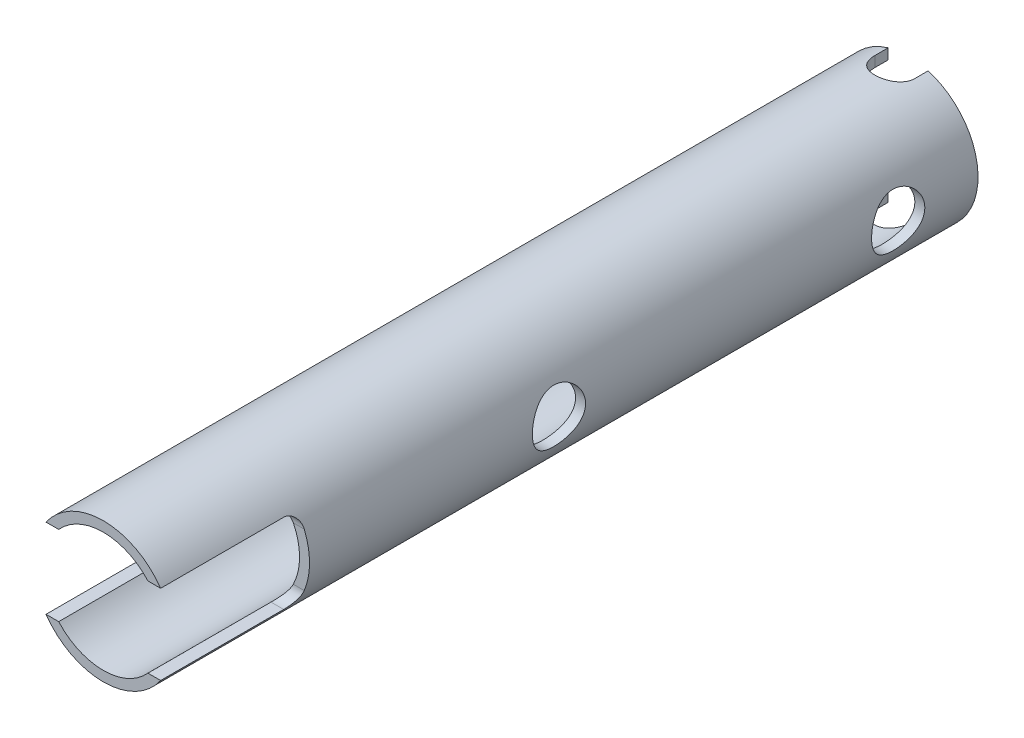
from build123d import *

# Parameters (mm, degrees)
EXTRUDE_1_DEPTH          = 20
EXTRUDE_1_DEPTH_BACK     = 118
SKETCH_1_R               = 10.5
SKETCH_1_R_2             = 9
CUT_EXTRUDE_1_DEPTH      = 119.930652062
CUT_EXTRUDE_1_DEPTH_BACK = 119.930652062
CUT_EXTRUDE_3_DEPTH      = 20
CUT_EXTRUDE_3_DEPTH_BACK = 119.930652179
CUT_EXTRUDE_4_DEPTH      = 20
CUT_EXTRUDE_4_DEPTH_BACK = 20
SKETCH_6_R               = 4
CUT_EXTRUDE_5_DEPTH      = 33
CUT_EXTRUDE_5_DEPTH_BACK = 33
FILLET_1_R               = 1
SKETCH_10_W              = 26.684789648
SKETCH_10_H              = 20.285983903
CUT_EXTRUDE_7_DEPTH      = 17
SKETCH_11_R              = 13.822655886
CUT_EXTRUDE_8_DEPTH      = 122.907752126


with BuildPart() as part:
    # 草图1 → 凸台-拉伸1 (new, two sides: drawn at the far end of the back side and taken through both)
    with BuildSketch(Plane.XY.offset(-EXTRUDE_1_DEPTH_BACK)):
        Circle(SKETCH_1_R)
        Circle(SKETCH_1_R_2, mode=Mode.SUBTRACT)
    extrude(amount=EXTRUDE_1_DEPTH + EXTRUDE_1_DEPTH_BACK)

    # 草图2 → 切除-拉伸1 (cut, two sides: drawn at the far end of the back side and taken through both)
    with BuildSketch(Plane(origin=(0, 0, 0), x_dir=(0, 0, -1), z_dir=(1, 0, 0)).offset(-CUT_EXTRUDE_1_DEPTH_BACK)):
        with BuildLine():
            Line((-15.5, -6), (15.5, -6))
            ThreePointArc((15.5, -6), (16.914213562, -5.414213562), (17.5, -4))
            Line((17.5, -4), (17.5, 4))
            ThreePointArc((17.5, 4), (16.914213562, 5.414213562), (15.5, 6))
            Line((15.5, 6), (-15.5, 6))
            ThreePointArc((-15.5, 6), (-16.914213562, 5.414213562), (-17.5, 4))
            Line((-17.5, 4), (-17.5, -4))
            ThreePointArc((-17.5, -4), (-16.914213562, -5.414213562), (-15.5, -6))
        make_face()
    extrude(amount=CUT_EXTRUDE_1_DEPTH + CUT_EXTRUDE_1_DEPTH_BACK, mode=Mode.SUBTRACT)

    # 草图5 → 切除-拉伸3 (cut, two sides: drawn at the far end of the back side and taken through both)
    with BuildSketch(Plane(origin=(0, 0, 0), x_dir=(1, 0, 0), z_dir=(0, 1, 0)).offset(-CUT_EXTRUDE_3_DEPTH_BACK)):
        with BuildLine():
            Line((3, 116), (3, 118))
            Line((3, 118), (-3, 118))
            Line((-3, 118), (-3, 116))
            ThreePointArc((-3, 116), (0, 113), (3, 116))
        make_face()
    extrude(amount=CUT_EXTRUDE_3_DEPTH + CUT_EXTRUDE_3_DEPTH_BACK, mode=Mode.SUBTRACT)

    # 草图6 → 切除-拉伸4 (cut, two sides: drawn at the far end of the back side and taken through both)
    with BuildSketch(Plane(origin=(0, 0, 0), x_dir=(0, 0, -1), z_dir=(1, 0, 0)).offset(-CUT_EXTRUDE_4_DEPTH_BACK)):
        with Locations((106, 0)):
            Circle(SKETCH_6_R)
        with Locations((55, 0)):
            Circle(SKETCH_6_R)
    extrude(amount=CUT_EXTRUDE_4_DEPTH + CUT_EXTRUDE_4_DEPTH_BACK, mode=Mode.SUBTRACT)

    # 草图8 → 切除-拉伸5 (cut, two sides: drawn at the far end of the back side and taken through both)
    with BuildSketch(Plane(origin=(0, 0, 0), x_dir=(1, 0, 0), z_dir=(0, 1, 0)).offset(-CUT_EXTRUDE_5_DEPTH_BACK)):
        with BuildLine():
            Line((4.5, -16), (-4.5, -16))
            ThreePointArc((-4.5, -16), (-5.207106781, -16.292893219), (-5.5, -17))
            Line((-5.5, -17), (-5.5, -24))
            Line((-5.5, -24), (5.5, -24))
            Line((5.5, -24), (5.5, -17))
            ThreePointArc((5.5, -17), (5.207106781, -16.292893219), (4.5, -16))
        make_face()
    extrude(amount=CUT_EXTRUDE_5_DEPTH + CUT_EXTRUDE_5_DEPTH_BACK, mode=Mode.SUBTRACT)

    # 圆角1
    fillet_1_edges = [part.edges().sort_by_distance(p)[0] for p in [
        (5.5, -8.034087667, 20),
        (-5.5, -8.034087667, 20),
        (5.5, 8.034087667, 20),
        (-5.5, 8.034087667, 20),
    ]]
    fillet(fillet_1_edges, radius=FILLET_1_R)

    # 草图10 → 切除-拉伸7 (cut)
    with BuildSketch(Plane.XY.offset(3)):
        with Locations((0, 4.142991952)):
            Rectangle(SKETCH_10_W, SKETCH_10_H)
    extrude(amount=CUT_EXTRUDE_7_DEPTH, mode=Mode.SUBTRACT)

    # 草图11 → 切除-拉伸8 (cut, through all)
    with BuildSketch(Plane.XY.offset(3)):
        Circle(SKETCH_11_R)
    extrude(amount=CUT_EXTRUDE_8_DEPTH, mode=Mode.SUBTRACT)


solid = part.part
